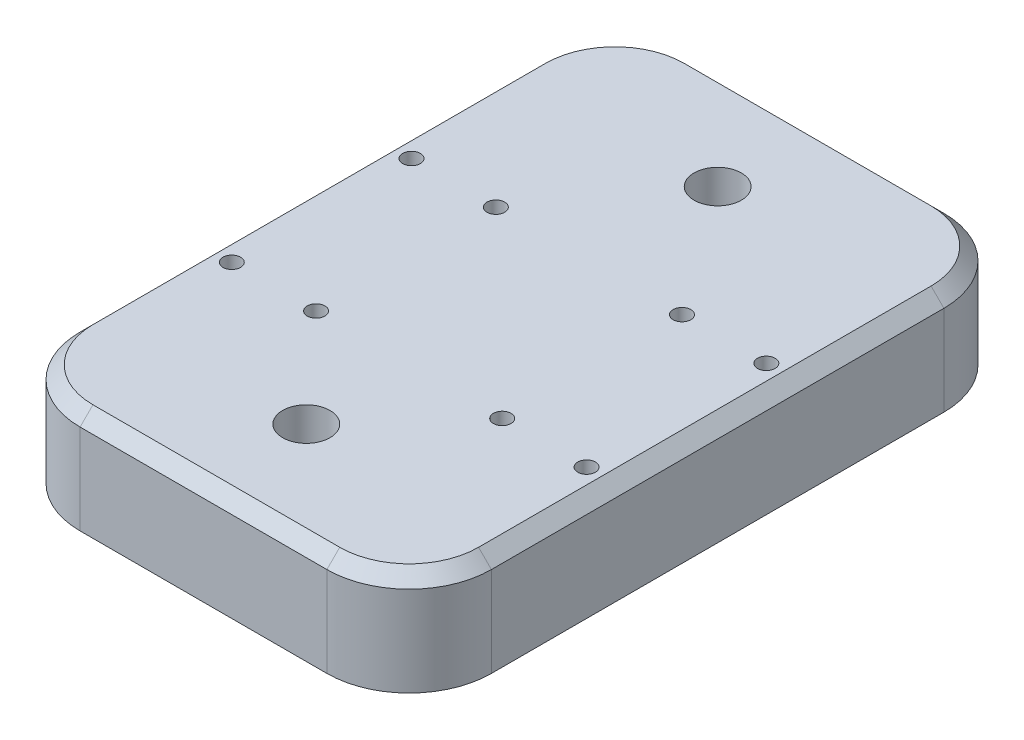
from build123d import *

# Parameters (mm, degrees)
SKETCH1_W           = 76.2
SKETCH1_H           = 12.7
BOSS_EXTRUDE1_DEPTH = 50.8
SKETCH3_R           = 1.0922
SKETCH3_R_2         = 2.921
CUT_EXTRUDE2_DEPTH  = 93.457395594
FILLET1_R           = 10.16
CHAMFER1_SIZE       = 1.5875


with BuildPart() as part:
    # Sketch1 → Boss-Extrude1 (new body)
    with BuildSketch(Plane(origin=(0, 0, 0), x_dir=(0, 0, -1), z_dir=(1, 0, 0))):
        with Locations((38.1, 6.35)):
            Rectangle(SKETCH1_W, SKETCH1_H)
    extrude(amount=BOSS_EXTRUDE1_DEPTH)

    # Sketch3 → Cut-Extrude2 (cut, through all)
    with BuildSketch(Plane.XZ):
        with Locations((13.9065, -25.4)):
            Circle(SKETCH3_R)
        with Locations((25.4, -63.5)):
            Circle(SKETCH3_R_2)
        with Locations((25.4, -12.7)):
            Circle(SKETCH3_R_2)
        with Locations((3.4925, -25.4)):
            Circle(SKETCH3_R)
        with Locations((3.4925, -47.5996)):
            Circle(SKETCH3_R)
        with Locations((13.9065, -47.5996)):
            Circle(SKETCH3_R)
        with Locations((47.3075, -25.4)):
            Circle(SKETCH3_R)
        with Locations((36.8935, -25.4)):
            Circle(SKETCH3_R)
        with Locations((36.8935, -47.5996)):
            Circle(SKETCH3_R)
        with Locations((47.3075, -47.5996)):
            Circle(SKETCH3_R)
    extrude(amount=-CUT_EXTRUDE2_DEPTH, mode=Mode.SUBTRACT)

    # Fillet1
    fillet1_edges = [part.edges().sort_by_distance(p)[0] for p in [
        (0, 6.35, 0),
        (50.8, 6.35, 0),
        (0, 6.35, -76.2),
        (50.8, 6.35, -76.2),
    ]]
    fillet(fillet1_edges, radius=FILLET1_R)

    # Chamfer1
    chamfer1_edges = [part.edges().sort_by_distance(p)[0] for p in [
        (0, 12.7, -38.1),
        (2.975795103, 12.7, -2.975795103),
        (25.4, 12.7, 0),
        (47.824204897, 12.7, -2.975795103),
        (50.8, 12.7, -38.1),
        (47.824204897, 12.7, -73.224204897),
        (25.4, 12.7, -76.2),
        (2.975795103, 12.7, -73.224204897),
    ]]
    chamfer(chamfer1_edges, length=CHAMFER1_SIZE)


solid = part.part
